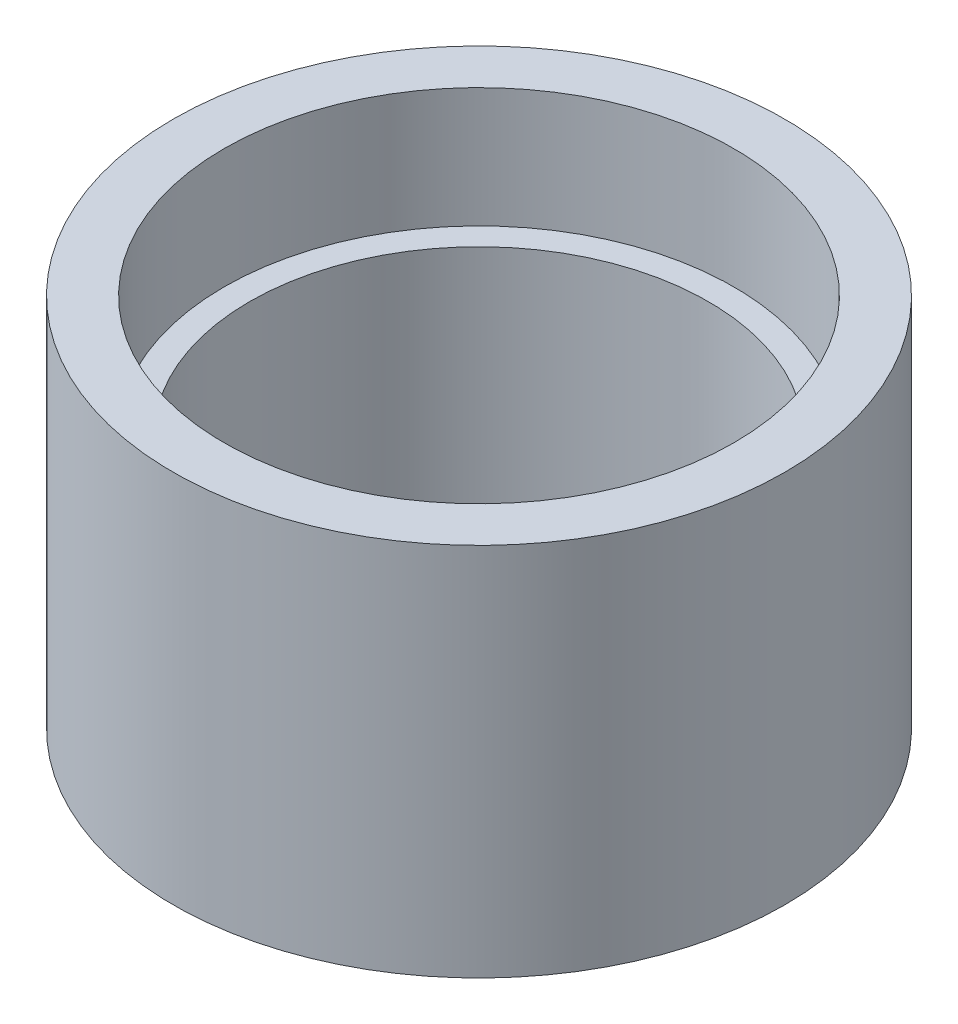
from build123d import *


with BuildPart() as part:
    # Sketch1 → Revolve1 (revolve)
    with BuildSketch(Plane.XY):
        Polygon((12, 0), (10, 0), (10, -4.7), (9, -4.7), (9, -14.7), (12, -14.7), align=None)
    revolve(axis=Axis((0, 0, 0), (0, -1, 0)))


solid = part.part
